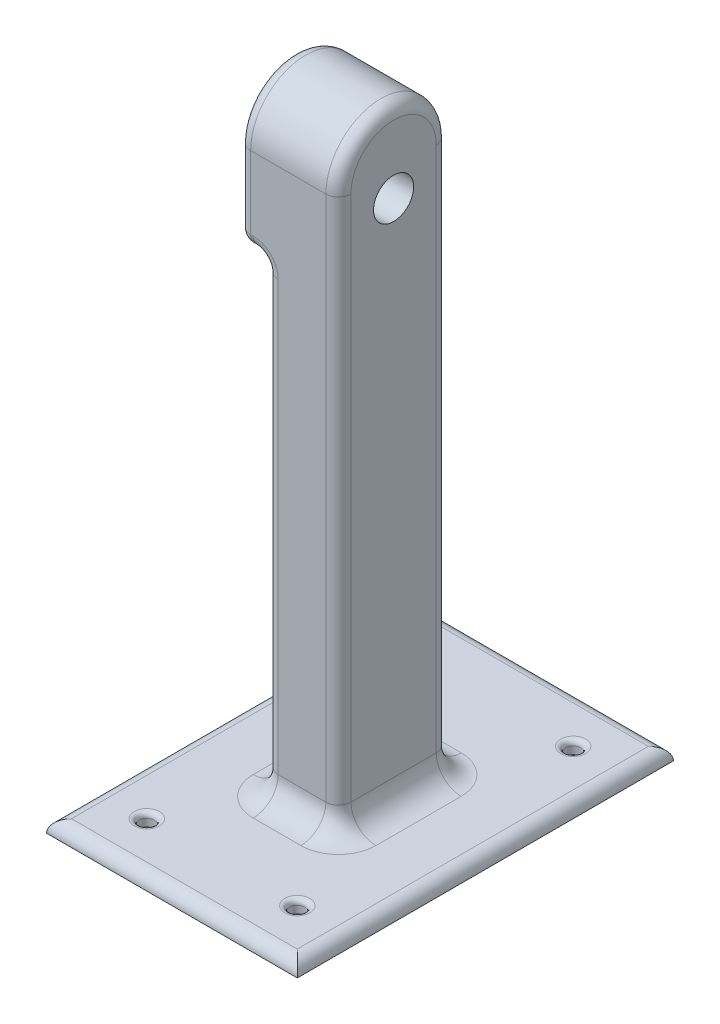
from build123d import *

# Parameters (mm, degrees)
SKETCH1_W           = 100
SKETCH1_H           = 150
SKETCH1_R           = 3
BOTTOM_DEPTH        = 5
SKETCH2_W           = 29
SKETCH2_H           = 44
SKETCH2_W_2         = 21
SKETCH2_H_2         = 36
BOSS_EXTRUDE2_DEPTH = 190
BOSS_EXTRUDE3_DEPTH = 40
SKETCH4_R           = 8
CUT_EXTRUDE1_DEPTH  = 40
SKETCH5_W           = 40
SKETCH5_H           = 44
BOSS_EXTRUDE4_DEPTH = 4
FILLET1_R           = 5
FILLET2_R           = 5
FILLET3_R           = 10
FILLET4_R           = 5
FILLET5_R           = 2


with BuildPart() as part:
    # Sketch1 → bottom (new body)
    with BuildSketch(Plane(origin=(0, 0, 0), x_dir=(1, 0, 0), z_dir=(0, 1, 0))):
        with Locations((50, -75)):
            Rectangle(SKETCH1_W, SKETCH1_H)
        with Locations(Location((20, -20, 0), (0, 0, 270))):
            Circle(SKETCH1_R, mode=Mode.SUBTRACT)
        with Locations(Location((80, -20, 0), (0, 0, 90))):
            Circle(SKETCH1_R, mode=Mode.SUBTRACT)
        with Locations(Location((80, -130, 0), (0, 0, 270))):
            Circle(SKETCH1_R, mode=Mode.SUBTRACT)
        with Locations(Location((20, -130, 0), (0, 0, 90))):
            Circle(SKETCH1_R, mode=Mode.SUBTRACT)
    extrude(amount=BOTTOM_DEPTH)

    # Sketch2 → Boss-Extrude2 (add)
    with BuildSketch(Plane(origin=(0, 5, 0), x_dir=(1, 0, 0), z_dir=(0, 1, 0))):
        with Locations((50.459110832, -76.558815358)):
            Rectangle(SKETCH2_W, SKETCH2_H)
        with Locations((50.459110832, -76.558815358)):
            Rectangle(SKETCH2_W_2, SKETCH2_H_2, mode=Mode.SUBTRACT)
    extrude(amount=BOSS_EXTRUDE2_DEPTH)

    # Sketch3 → Boss-Extrude3 (add)
    with BuildSketch(Plane(origin=(64.959110832, 0, 0), x_dir=(0, 0, -1), z_dir=(1, 0, 0))):
        with BuildLine():
            Line((-98.558815358, 195), (-98.558815358, 225))
            ThreePointArc((-98.558815358, 225), (-76.558815358, 247), (-54.558815358, 225))
            Line((-54.558815358, 225), (-54.558815358, 195))
            Line((-54.558815358, 195), (-98.558815358, 195))
        make_face()
    extrude(amount=-BOSS_EXTRUDE3_DEPTH)

    # Sketch4 → Cut-Extrude1 (cut)
    with BuildSketch(Plane(origin=(64.959110832, 0, 0), x_dir=(0, 0, -1), z_dir=(1, 0, 0))):
        with Locations((-76.558815358, 215)):
            Circle(SKETCH4_R)
    extrude(amount=-CUT_EXTRUDE1_DEPTH, mode=Mode.SUBTRACT)

    # Sketch5 → Boss-Extrude4 (add)
    with BuildSketch(Plane.XZ.offset(-195)):
        with Locations((44.959110832, 76.558815358)):
            Rectangle(SKETCH5_W, SKETCH5_H)
    extrude(amount=BOSS_EXTRUDE4_DEPTH)

    # Fillet1
    fillet1_edges = [part.edges().sort_by_distance(p)[0] for p in [
        (24.959110832, 208, 98.558815358),
        (24.959110832, 247, 76.558815358),
        (24.959110832, 208, 54.558815358),
        (24.959110832, 215, 84.558815358),
        (35.959110832, 98, 98.558815358),
        (35.959110832, 98, 54.558815358),
        (30.459110832, 191, 98.558815358),
        (24.959110832, 191, 76.558815358),
        (30.459110832, 191, 54.558815358),
        (35.959110832, 191, 76.558815358),
    ]]
    fillet(fillet1_edges, radius=FILLET1_R)

    # Fillet2
    fillet2_edges = [part.edges().sort_by_distance(p)[0] for p in [
        (64.959110832, 115, 54.558815358),
        (64.959110832, 115, 98.558815358),
        (64.959110832, 247, 76.558815358),
    ]]
    fillet(fillet2_edges, radius=FILLET2_R)

    # Fillet3
    fillet3_edges = [part.edges().sort_by_distance(p)[0] for p in [
        (50.459110832, 5, 98.558815358),
        (50.459110832, 5, 54.558815358),
        (35.959110832, 5, 76.558815358),
        (37.423576926, 5, 97.094349264),
        (37.423576926, 5, 56.023281452),
        (64.959110832, 5, 76.558815358),
        (63.494644738, 5, 56.023281452),
        (63.494644738, 5, 97.094349264),
    ]]
    fillet(fillet3_edges, radius=FILLET3_R)

    # Fillet4
    fillet4_edges = [part.edges().sort_by_distance(p)[0] for p in [
        (50, 5, 150),
        (100, 5, 75),
        (50, 5, 0),
        (0, 5, 75),
    ]]
    fillet(fillet4_edges, radius=FILLET4_R - 0.0001)  # a hair under: the kernel refuses the full size

    # Fillet5
    fillet5_edges = [part.edges().sort_by_distance(p)[0] for p in [
        (20, 5, 17),
        (80, 5, 23),
        (80, 5, 127),
        (20, 5, 133),
    ]]
    fillet(fillet5_edges, radius=FILLET5_R)


solid = part.part
